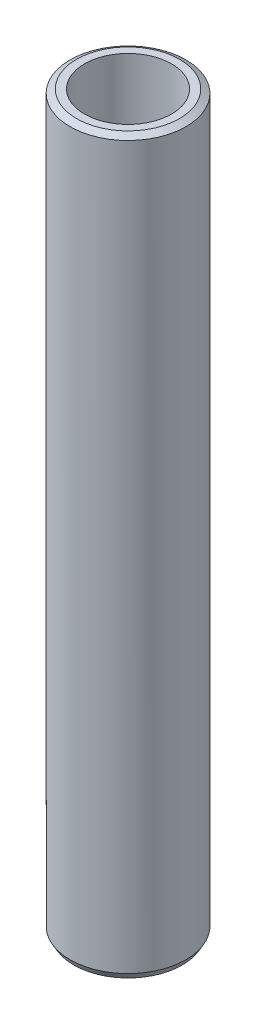
from build123d import *
from OCP.BRepFilletAPI import BRepFilletAPI_MakeChamfer

# Parameters (mm, degrees)
SKETCH1_R           = 47.5
BOSS_EXTRUDE1_DEPTH = 600
SKETCH2_R           = 35.69350959
CUT_EXTRUDE1_DEPTH  = 604.748706003
CHAMFER1_SIZE       = 3.062107418
CHAMFER1_SIZE2      = 5.303725627


with BuildPart() as part:
    # Sketch1 → Boss-Extrude1 (new body)
    with BuildSketch(Plane(origin=(0, 0, 0), x_dir=(1, 0, 0), z_dir=(0, 1, 0))):
        Circle(SKETCH1_R)
    extrude(amount=BOSS_EXTRUDE1_DEPTH)

    # Sketch2 → Cut-Extrude1 (cut, through all)
    with BuildSketch(Plane(origin=(0, 0, 0), x_dir=(1, 0, 0), z_dir=(0, 1, 0))):
        Circle(SKETCH2_R)
    extrude(amount=CUT_EXTRUDE1_DEPTH, mode=Mode.SUBTRACT)

    # Chamfer1: one chamfer whose edges measure the first distance from different faces: ONE call of the kernel's chamfer builder (chamfer() names one face for all edges)
    chamfer1_edges_1 = [part.edges().sort_by_distance(p)[0] for p in [
        (-47.5, 600, 0),
    ]]
    chamfer1_side_1 = [part.faces().sort_by_distance(p)[0] for p in [
        (-47.5, 300, 0),
    ]]
    chamfer1_edges_2 = [part.edges().sort_by_distance(p)[0] for p in [
        (-47.5, 0, 0),
    ]]
    chamfer1_side_2 = [part.faces().sort_by_distance(p)[0] for p in [
        (-46.156497116, 0, 0),
    ]]
    chamfer1 = BRepFilletAPI_MakeChamfer(part.part.solid().wrapped)
    for e in chamfer1_edges_1:
        chamfer1.Add(CHAMFER1_SIZE, CHAMFER1_SIZE2, e.wrapped, chamfer1_side_1[0].wrapped)  # the first distance lies on this face
    for e in chamfer1_edges_2:
        chamfer1.Add(CHAMFER1_SIZE, CHAMFER1_SIZE2, e.wrapped, chamfer1_side_2[0].wrapped)  # the first distance lies on this face
    add(Compound.cast(chamfer1.Shape()), mode=Mode.REPLACE)


solid = part.part
